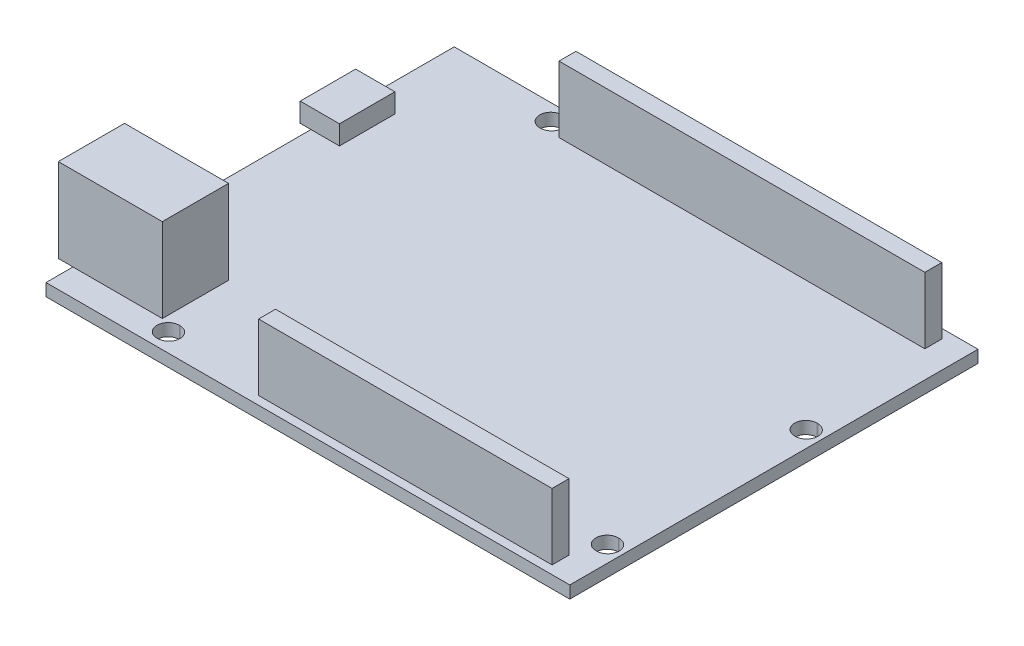
from build123d import *

# Parameters (mm, degrees)
SKETCH1_W                  = 68
SKETCH1_H                  = 53
BOSS_EXTRUDE1_DEPTH        = 1.6
M2_5_CLEARANCE_SLOT1_DEPTH = 1.6
SKETCH4_W                  = 47.5
SKETCH4_H                  = 2.2
SKETCH4_W_2                = 38.1
BOSS_EXTRUDE2_DEPTH        = 8.6
SKETCH5_W                  = 13.5
SKETCH5_H                  = 8.6
BOSS_EXTRUDE3_DEPTH        = 10.9
SKETCH6_W                  = 5.1
SKETCH6_H                  = 7.2
BOSS_EXTRUDE4_DEPTH        = 2.5


# Read off the part's stored shape, not the designer's step: M2.5 Clearance Slot1
with BuildPart() as part:
    # Sketch1 → Boss-Extrude1 (new body)
    with BuildSketch(Plane(origin=(0, 0, 0), x_dir=(1, 0, 0), z_dir=(0, 1, 0))):
        with Locations((34, 26.5)):
            Rectangle(SKETCH1_W, SKETCH1_H)
    extrude(amount=BOSS_EXTRUDE1_DEPTH)

    # M2.5 Clearance Slot1 outline → M2.5 Clearance Slot1 (cut)
    with BuildSketch(Plane(origin=(0, 0, 0), x_dir=(1, 0, 0), z_dir=(0, 1, 0))):
        with BuildLine():
            Line((14.65, 49.45), (14.75, 49.45))
            ThreePointArc((14.75, 49.45), (16.2, 50.9), (14.75, 52.35))
            Line((14.75, 52.35), (14.65, 52.35))
            ThreePointArc((14.65, 52.35), (13.2, 50.9), (14.65, 49.45))
        make_face()
        with BuildLine():
            Line((65.85, 31.35), (65.95, 31.35))
            ThreePointArc((65.95, 31.35), (67.4, 32.8), (65.95, 34.25))
            Line((65.95, 34.25), (65.85, 34.25))
            ThreePointArc((65.85, 34.25), (64.4, 32.8), (65.85, 31.35))
        make_face()
        with BuildLine():
            Line((65.85, 5.55), (65.95, 5.55))
            ThreePointArc((65.95, 5.55), (67.4, 7), (65.95, 8.45))
            Line((65.95, 8.45), (65.85, 8.45))
            ThreePointArc((65.85, 8.45), (64.4, 7), (65.85, 5.55))
        make_face()
        with BuildLine():
            Line((13.45, 0.95), (13.55, 0.95))
            ThreePointArc((13.55, 0.95), (15, 2.4), (13.55, 3.85))
            Line((13.55, 3.85), (13.45, 3.85))
            ThreePointArc((13.45, 3.85), (12, 2.4), (13.45, 0.95))
        make_face()
    extrude(amount=M2_5_CLEARANCE_SLOT1_DEPTH, mode=Mode.SUBTRACT)

    # Sketch4 → Boss-Extrude2 (add)
    with BuildSketch(Plane(origin=(0, 1.6, 0), x_dir=(1, 0, 0), z_dir=(0, 1, 0))):
        with Locations((40.75, 50.7)):
            Rectangle(SKETCH4_W, SKETCH4_H)
        with Locations((45.55, 2.2)):
            Rectangle(SKETCH4_W_2, SKETCH4_H)
    extrude(amount=BOSS_EXTRUDE2_DEPTH)

    # Sketch5 → Boss-Extrude3 (add)
    with BuildSketch(Plane(origin=(0, 1.6, 0), x_dir=(1, 0, 0), z_dir=(0, 1, 0))):
        with Locations((4.85, 7.8)):
            Rectangle(SKETCH5_W, SKETCH5_H)
    extrude(amount=BOSS_EXTRUDE3_DEPTH)

    # Sketch6 → Boss-Extrude4 (add)
    with BuildSketch(Plane(origin=(0, 1.6, 0), x_dir=(1, 0, 0), z_dir=(0, 1, 0))):
        with Locations((1.15, 38)):
            Rectangle(SKETCH6_W, SKETCH6_H)
    extrude(amount=BOSS_EXTRUDE4_DEPTH)


solid = part.part
